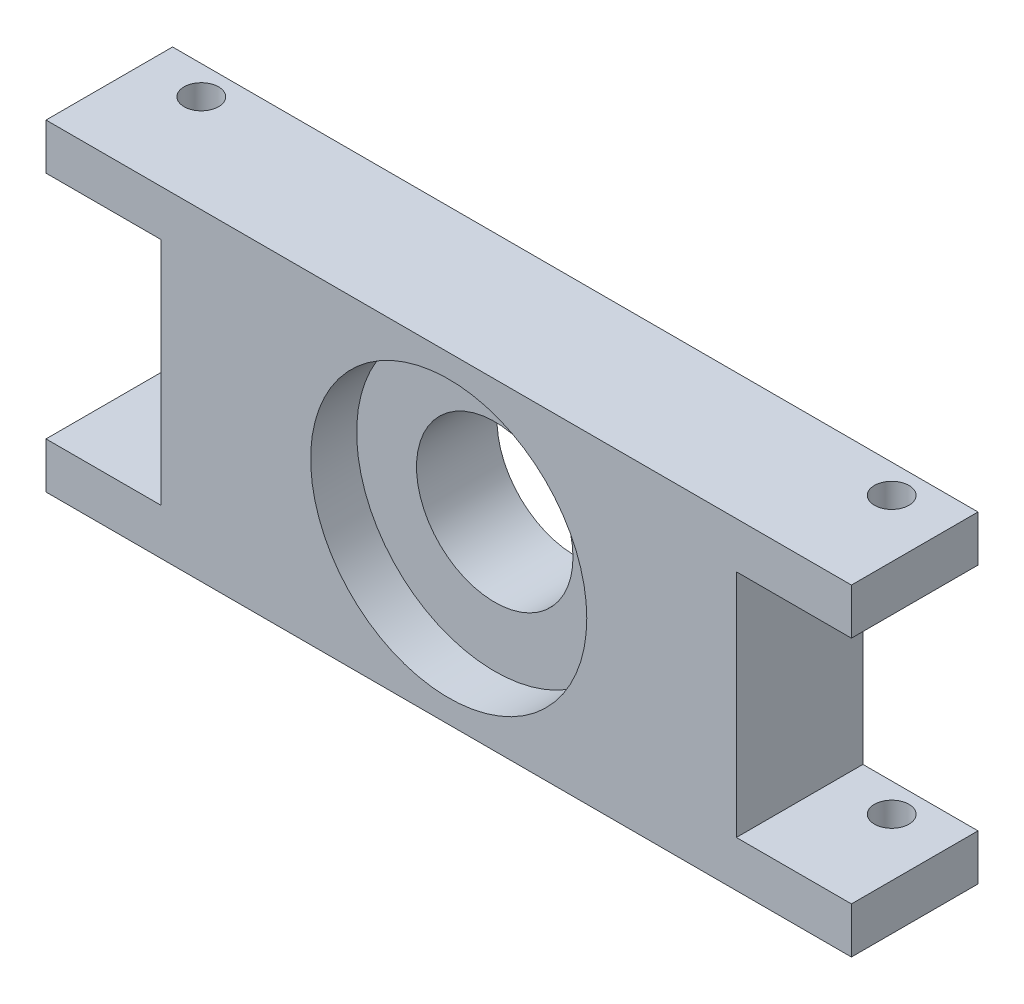
from build123d import *

# Parameters (mm, degrees)
ESQUISSE1_W             = 70
ESQUISSE1_H             = 28
BOSS_EXTRU_1_DEPTH      = 11
ESQUISSE2_R             = 1.5
ENL_V_MAT_EXTRU_1_DEPTH = 47.151923037
ESQUISSE3_R             = 6.8
ENL_V_MAT_EXTRU_2_DEPTH = 40.268307832
ESQUISSE4_R             = 12
ENL_V_MAT_EXTRU_3_DEPTH = 4
ESQUISSE5_W             = 10
ESQUISSE5_H             = 20
ENL_V_MAT_EXTRU_4_DEPTH = 40.268307832
ESQUISSE6_W             = 10
ESQUISSE6_H             = 20
ENL_V_MAT_EXTRU_5_DEPTH = 40.268307832


with BuildPart() as part:
    # Esquisse1 → Boss.-Extru.1 (new body)
    with BuildSketch(Plane.XY):
        Rectangle(ESQUISSE1_W, ESQUISSE1_H)
    extrude(amount=BOSS_EXTRU_1_DEPTH)

    # Esquisse2 → Enlèv. mat.-Extru.1 (cut, through all)
    with BuildSketch(Plane(origin=(0, 14, 0), x_dir=(1, 0, 0), z_dir=(0, 1, 0))):
        with Locations((30, -2.5)):
            Circle(ESQUISSE2_R)
        with Locations((-30, -2.5)):
            Circle(ESQUISSE2_R)
    extrude(amount=-ENL_V_MAT_EXTRU_1_DEPTH, mode=Mode.SUBTRACT)

    # Esquisse3 → Enlèv. mat.-Extru.2 (cut, through all)
    with BuildSketch(Plane.XY.offset(11)):
        Circle(ESQUISSE3_R)
    extrude(amount=-ENL_V_MAT_EXTRU_2_DEPTH, mode=Mode.SUBTRACT)

    # Esquisse4 → Enlèv. mat.-Extru.3 (cut)
    with BuildSketch(Plane.XY.offset(11)):
        Circle(ESQUISSE4_R)
    extrude(amount=-ENL_V_MAT_EXTRU_3_DEPTH, mode=Mode.SUBTRACT)

    # Esquisse5 → Enlèv. mat.-Extru.4 (cut, through all)
    with BuildSketch(Plane.XY.offset(11)):
        with Locations((-30, 0)):
            Rectangle(ESQUISSE5_W, ESQUISSE5_H)
    extrude(amount=-ENL_V_MAT_EXTRU_4_DEPTH, mode=Mode.SUBTRACT)

    # Esquisse6 → Enlèv. mat.-Extru.5 (cut, through all)
    with BuildSketch(Plane.XY.offset(11)):
        with Locations((30, 0)):
            Rectangle(ESQUISSE6_W, ESQUISSE6_H)
    extrude(amount=-ENL_V_MAT_EXTRU_5_DEPTH, mode=Mode.SUBTRACT)


solid = part.part
